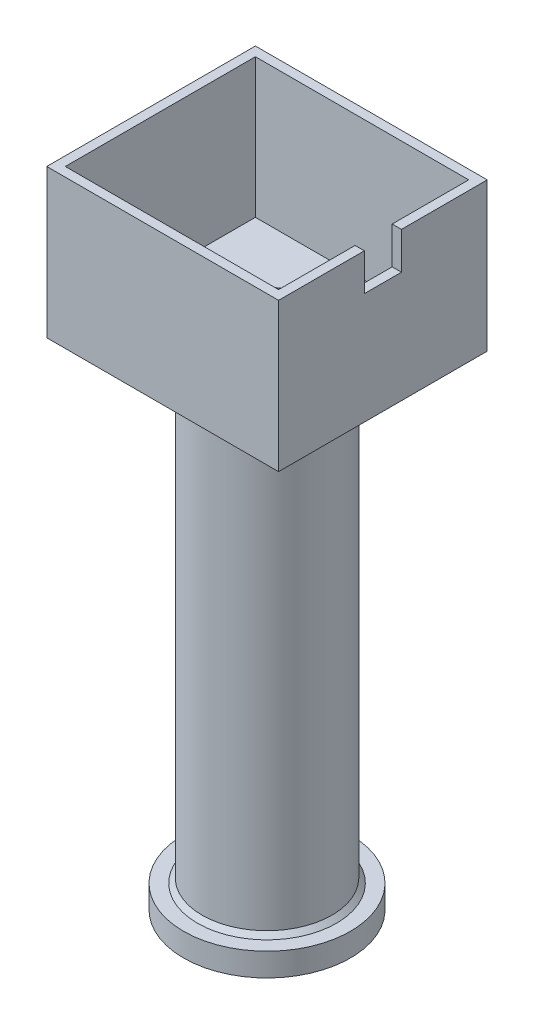
from build123d import *

# Parameters (mm, degrees)
SKETCH1_R           = 18
BOSS_EXTRUDE1_DEPTH = 4
SKETCH2_R           = 14
SKETCH2_R_2         = 12.25
BOSS_EXTRUDE2_DEPTH = 101.6
SKETCH3_R           = 18
SKETCH3_R_2         = 12.25
BOSS_EXTRUDE3_DEPTH = 1
CHAMFER1_SIZE       = 1
SKETCH4_W           = 50
SKETCH4_H           = 45
SKETCH4_R           = 12.25
BOSS_EXTRUDE4_DEPTH = 2
SKETCH5_W           = 50
SKETCH5_H           = 45
SKETCH5_W_2         = 46
SKETCH5_H_2         = 41
BOSS_EXTRUDE5_DEPTH = 30
CHAMFER2_SIZE       = 5
SKETCH6_W           = 8
SKETCH6_H           = 8
CUT_EXTRUDE1_DEPTH  = 20


with BuildPart() as part:
    # Sketch1 → Boss-Extrude1 (new body)
    with BuildSketch(Plane(origin=(0, 0, 0), x_dir=(1, 0, 0), z_dir=(0, 1, 0))):
        Circle(SKETCH1_R)
        Polygon((8.082903769, -14), (16.165807537, 0), (8.082903769, 14), (-8.082903769, 14), (-16.165807537, 0), (-8.082903769, -14), align=None, mode=Mode.SUBTRACT)
    extrude(amount=BOSS_EXTRUDE1_DEPTH)



with BuildPart() as body_2:
    # Sketch2 → Boss-Extrude2 (new body)
    with BuildSketch(Plane(origin=(0, 4, 0), x_dir=(1, 0, 0), z_dir=(0, 1, 0))):
        Circle(SKETCH2_R)
        Circle(SKETCH2_R_2, mode=Mode.SUBTRACT)
    extrude(amount=BOSS_EXTRUDE2_DEPTH)


with BuildPart() as part_1:
    add(part.part)

    add(body_2.part)  # Boss-Extrude3 merges body 2
    # Sketch3 → Boss-Extrude3 (add)
    with BuildSketch(Plane(origin=(0, 4, 0), x_dir=(1, 0, 0), z_dir=(0, 1, 0))):
        Circle(SKETCH3_R)
        Circle(SKETCH3_R_2, mode=Mode.SUBTRACT)
    extrude(amount=BOSS_EXTRUDE3_DEPTH)

    # Chamfer1
    chamfer1_edges = [part_1.edges().sort_by_distance(p)[0] for p in [
        (-14, 5, 0),
    ]]
    chamfer(chamfer1_edges, length=CHAMFER1_SIZE)

    # Sketch4 → Boss-Extrude4 (add)
    with BuildSketch(Plane(origin=(0, 105.6, 0), x_dir=(1, 0, 0), z_dir=(0, 1, 0))):
        Rectangle(SKETCH4_W, SKETCH4_H)
        Circle(SKETCH4_R, mode=Mode.SUBTRACT)
    extrude(amount=BOSS_EXTRUDE4_DEPTH)

    # Sketch5 → Boss-Extrude5 (add)
    with BuildSketch(Plane(origin=(0, 107.6, 0), x_dir=(1, 0, 0), z_dir=(0, 1, 0))):
        Rectangle(SKETCH5_W, SKETCH5_H)
        Rectangle(SKETCH5_W_2, SKETCH5_H_2, mode=Mode.SUBTRACT)
    extrude(amount=BOSS_EXTRUDE5_DEPTH)

    # Chamfer2
    chamfer2_edges = [part_1.edges().sort_by_distance(p)[0] for p in [
        (-14, 105.6, 0),
    ]]
    chamfer(chamfer2_edges, length=CHAMFER2_SIZE)

    # Sketch6 → Cut-Extrude1 (cut)
    with BuildSketch(Plane(origin=(25, 0, 0), x_dir=(0, 0, -1), z_dir=(1, 0, 0))):
        with Locations((0, 133.6)):
            Rectangle(SKETCH6_W, SKETCH6_H)
    extrude(amount=-CUT_EXTRUDE1_DEPTH, mode=Mode.SUBTRACT)


solid = part_1.part
